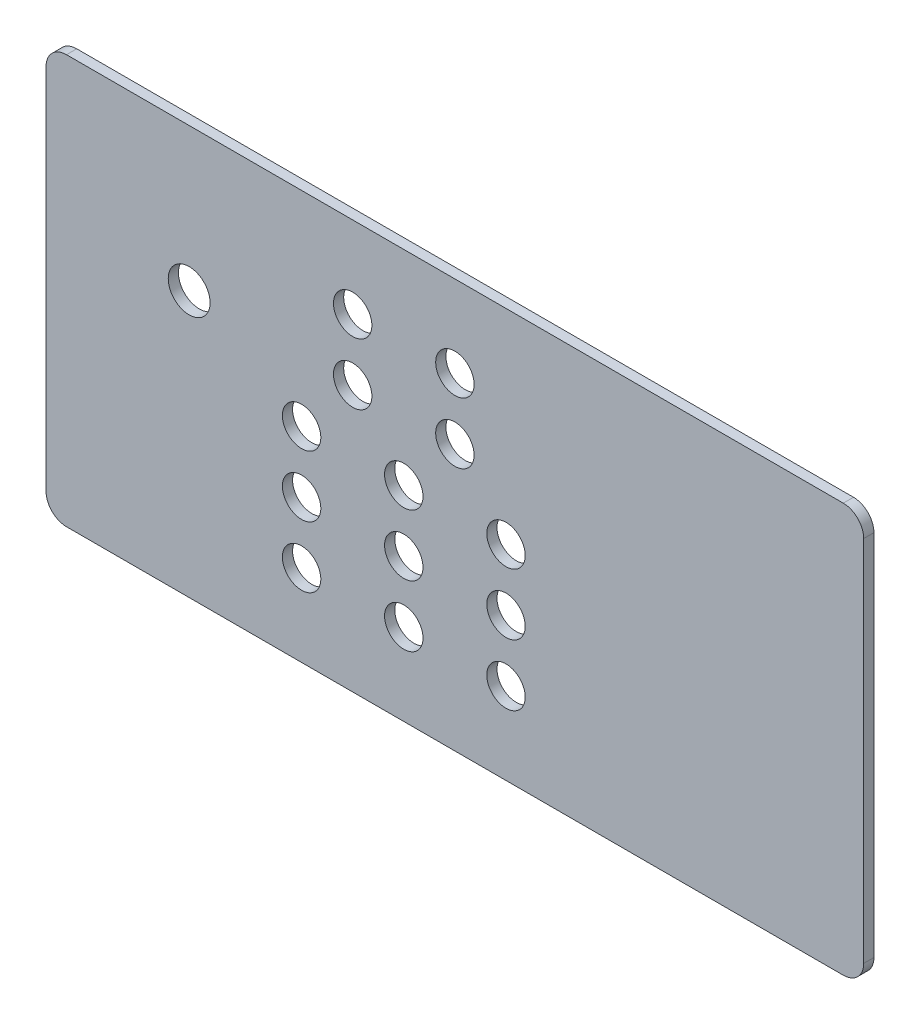
from build123d import *

# Parameters (mm, degrees)
SKETCH1_W           = 508
SKETCH1_H           = 254
BOSS_EXTRUDE1_DEPTH = 6.35
SKETCH3_R           = 11.938
SKETCH3_R_2         = 13
CUT_EXTRUDE2_DEPTH  = 568.996762755
FILLET1_R           = 12.7


with BuildPart() as part:
    # Sketch1 → Boss-Extrude1 (new body)
    with BuildSketch(Plane.XY):
        with Locations((254, 127)):
            Rectangle(SKETCH1_W, SKETCH1_H)
    extrude(amount=BOSS_EXTRUDE1_DEPTH)

    # Sketch3 → Cut-Extrude2 (cut, through all)
    with BuildSketch(Plane(origin=(0, 0, 0), x_dir=(-1, 0, 0), z_dir=(0, 0, -1))):
        with Locations((-158.75, 88.9)):
            Circle(SKETCH3_R)
        with Locations((-222.25, 88.9)):
            Circle(SKETCH3_R)
        with Locations((-158.75, 50.8)):
            Circle(SKETCH3_R)
        with Locations((-222.25, 50.8)):
            Circle(SKETCH3_R)
        with Locations((-222.25, 127)):
            Circle(SKETCH3_R)
        with Locations((-285.75, 127)):
            Circle(SKETCH3_R)
        with Locations((-285.75, 88.9)):
            Circle(SKETCH3_R)
        with Locations((-285.75, 50.8)):
            Circle(SKETCH3_R)
        with Locations((-254, 203.2)):
            Circle(SKETCH3_R)
        with Locations((-190.5, 203.2)):
            Circle(SKETCH3_R)
        with Locations((-158.75, 127)):
            Circle(SKETCH3_R)
        with Locations((-190.5, 165.1)):
            Circle(SKETCH3_R)
        with Locations((-254, 165.1)):
            Circle(SKETCH3_R)
        with Locations((-88.9, 165.1)):
            Circle(SKETCH3_R_2)
    extrude(amount=-CUT_EXTRUDE2_DEPTH, mode=Mode.SUBTRACT)

    # Fillet1
    fillet1_edges = [part.edges().sort_by_distance(p)[0] for p in [
        (508, 0, 3.175),
        (0, 0, 3.175),
        (0, 254, 3.175),
        (508, 254, 3.175),
    ]]
    fillet(fillet1_edges, radius=FILLET1_R)


solid = part.part
